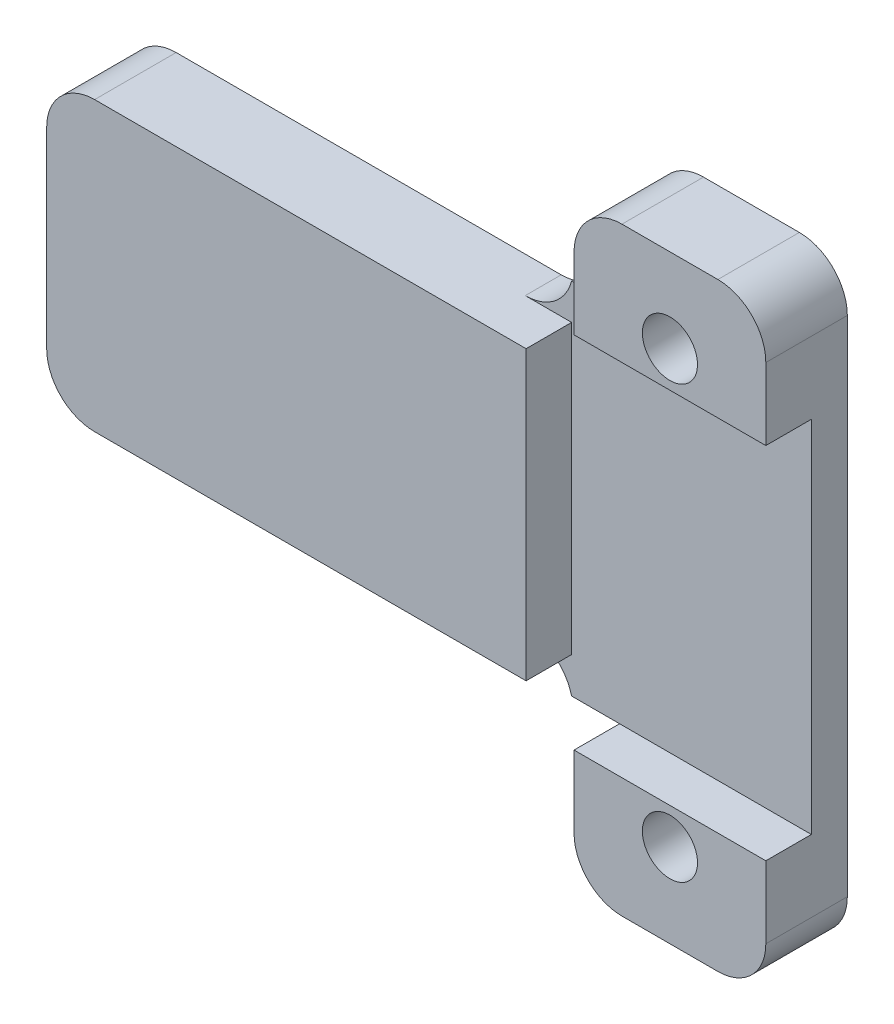
from build123d import *

# Parameters (mm, degrees)
DODANIE_WYCI_GNI_CIE1_DEPTH = 3.4
DODANIE_WYCI_GNI_CIE2_DEPTH = 1.5
ZAOKR_GLENIE1_R             = 2
SZKIC4_W                    = 8
SZKIC4_H                    = 5
DODANIE_WYCI_GNI_CIE3_DEPTH = 3.4
ZAOKR_GLENIE2_R             = 2
SZKIC6_R                    = 1.15
WYTNIJ_WYCI_GNI_CIE1_DEPTH  = 3.5


with BuildPart() as part:
    # Szkic1 → Dodanie-wyciągnięcie1 (new body)
    with BuildSketch(Plane.XY):
        Polygon((0, 0), (0, 6), (20, 6), (20, -6), (0, -6), align=None)
    extrude(amount=DODANIE_WYCI_GNI_CIE1_DEPTH)

    # Szkic3 → Dodanie-wyciągnięcie2 (add)
    with BuildSketch(Plane.XY):
        Polygon((20, 6), (20, 7.5), (30, 7.5), (30, -7.5), (20, -7.5), (20, -6), align=None)
    extrude(amount=DODANIE_WYCI_GNI_CIE2_DEPTH)

    # Zaokrąglenie1
    # the kernel refuses this fillet: 2 mm, written as the material it adds along each edge
    with BuildSketch(Plane(origin=(20, -6, 0), x_dir=(-1, 0, 0), z_dir=(0, 0, 1))) as zaokr_glenie1_piece_1:
        with BuildLine():
            CenterArc((1.936491673, 2), ZAOKR_GLENIE1_R, 194.477512186, 75.522487814)
            Line((0, 1.5), (0, 0))
            Line((0, 0), (1.936491673, 0))
        make_face()
    extrude(amount=1.5)
    with BuildSketch(Plane(origin=(20, 6, 0), x_dir=(-1, 0, 0), z_dir=(0, 0, 1))) as zaokr_glenie1_piece_2:
        with BuildLine():
            CenterArc((1.936491673, -2), ZAOKR_GLENIE1_R, 90, 75.522487814)
            Line((0, -1.5), (0, 0))
            Line((0, 0), (1.936491673, 0))
        make_face()
    extrude(amount=1.5)
    # the kernel refuses this fillet: 2 mm, written as the material it takes off along each edge
    with BuildSketch(Plane(origin=(0, -6, -5), x_dir=(0, 1, 0), z_dir=(0, 0, 1))) as zaokr_glenie1_2_piece_1:
        with BuildLine():
            CenterArc((ZAOKR_GLENIE1_R, -ZAOKR_GLENIE1_R), ZAOKR_GLENIE1_R, 90, 90)
            Line((0, -ZAOKR_GLENIE1_R), (0, 0))
            Line((0, 0), (ZAOKR_GLENIE1_R, 0))
        make_face()
    extrude(amount=13.4, mode=Mode.SUBTRACT)
    with BuildSketch(Plane(origin=(0, 6, -5), x_dir=(0, -1, 0), z_dir=(0, 0, 1))) as zaokr_glenie1_2_piece_2:
        with BuildLine():
            CenterArc((ZAOKR_GLENIE1_R, ZAOKR_GLENIE1_R), ZAOKR_GLENIE1_R, 180, 90)
            Line((0, ZAOKR_GLENIE1_R), (0, 0))
            Line((0, 0), (ZAOKR_GLENIE1_R, 0))
        make_face()
    extrude(amount=13.4, mode=Mode.SUBTRACT)

    # Szkic4 → Dodanie-wyciągnięcie3 (add)
    with BuildSketch(Plane.XY):
        with Locations((26, 10)):
            Rectangle(SZKIC4_W, SZKIC4_H)
        with Locations((26, -10)):
            Rectangle(SZKIC4_W, SZKIC4_H)
    extrude(amount=DODANIE_WYCI_GNI_CIE3_DEPTH)

    # Zaokrąglenie2
    zaokr_glenie2_edges = [part.edges().sort_by_distance(p)[0] for p in [
        (30, 12.5, 1.7),
        (22, 12.5, 1.7),
        (22, -12.5, 1.7),
        (30, -12.5, 1.7),
    ]]
    fillet(zaokr_glenie2_edges, radius=ZAOKR_GLENIE2_R)

    # Szkic6 → Wytnij-wyciągnięcie1 (cut)
    with BuildSketch(Plane.XY):
        with Locations(Location((26, 9, 0), (0, 0, 180))):
            Circle(SZKIC6_R)
        with Locations((26, -9)):
            Circle(SZKIC6_R)
    extrude(amount=WYTNIJ_WYCI_GNI_CIE1_DEPTH, mode=Mode.SUBTRACT)


solid = part.part
